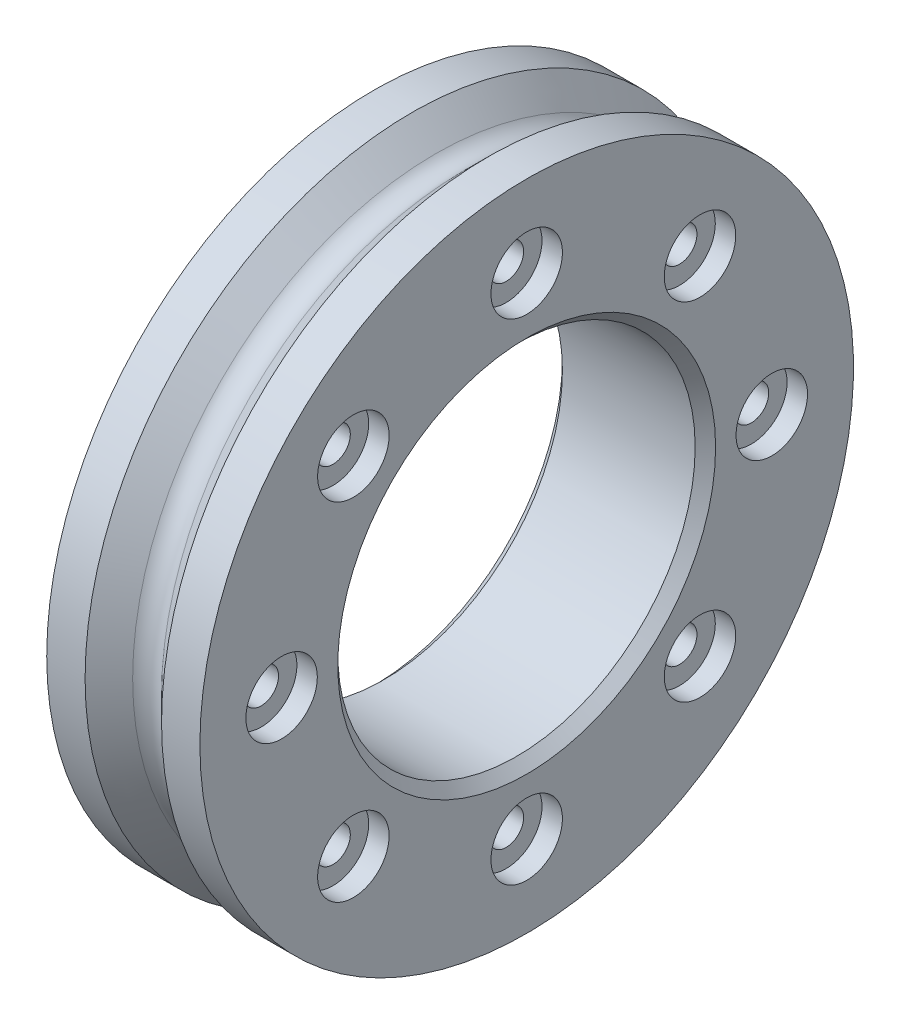
from build123d import *

# Parameters (mm, degrees)
CHAMFER1_SIZE                                = 1
FILLET1_R                                    = 2
CBORE_FOR_M3_HEX_HEAD_CAP_SCREW1_D           = 3.4
CBORE_FOR_M3_HEX_HEAD_CAP_SCREW1_CBORE_D     = 7
CBORE_FOR_M3_HEX_HEAD_CAP_SCREW1_CBORE_DEPTH = 2
CIRPATTERN1_COUNT                            = 8


with BuildPart() as part:
    # Sketch1 → Revolve1 (revolve)
    with BuildSketch(Plane.XY):
        Polygon((7.5, 32), (3.742640687, 32), (0, 28.257359313), (-3.742640687, 32), (-7.5, 32), (-7.5, 17.5), (7.5, 17.5), align=None)
    revolve(axis=Axis((-33.732241936, 0, 0), (1, 0, 0)))

    # Chamfer1
    chamfer1_edges = [part.edges().sort_by_distance(p)[0] for p in [
        (7.5, -17.5, 0),
        (-7.5, -17.5, 0),
    ]]
    chamfer(chamfer1_edges, length=CHAMFER1_SIZE)

    # Fillet1
    fillet1_edges = [part.edges().sort_by_distance(p)[0] for p in [
        (0, -28.257359313, 0),
    ]]
    fillet(fillet1_edges, radius=FILLET1_R)

    # CBORE for M3 Hex Head Cap Screw1 (through all)
    with Locations(Plane(origin=(7.5, 24, 0), x_dir=(0, 0, 1), z_dir=(1, 0, 0))):
        with Locations((0, 0)):
            cbore_for_m3_hex_head_cap_screw1 = CounterBoreHole(CBORE_FOR_M3_HEX_HEAD_CAP_SCREW1_D / 2, CBORE_FOR_M3_HEX_HEAD_CAP_SCREW1_CBORE_D / 2, CBORE_FOR_M3_HEX_HEAD_CAP_SCREW1_CBORE_DEPTH)

    # CirPattern1: CBORE for M3 Hex Head Cap Screw1 ×8 about axis
    cirpattern1_axis = Axis((7.5, 0, 0), (-1, 0, 0))
    for i in range(1, CIRPATTERN1_COUNT):
        add(cbore_for_m3_hex_head_cap_screw1.rotate(cirpattern1_axis, i * 360 / CIRPATTERN1_COUNT), mode=Mode.SUBTRACT)


solid = part.part
